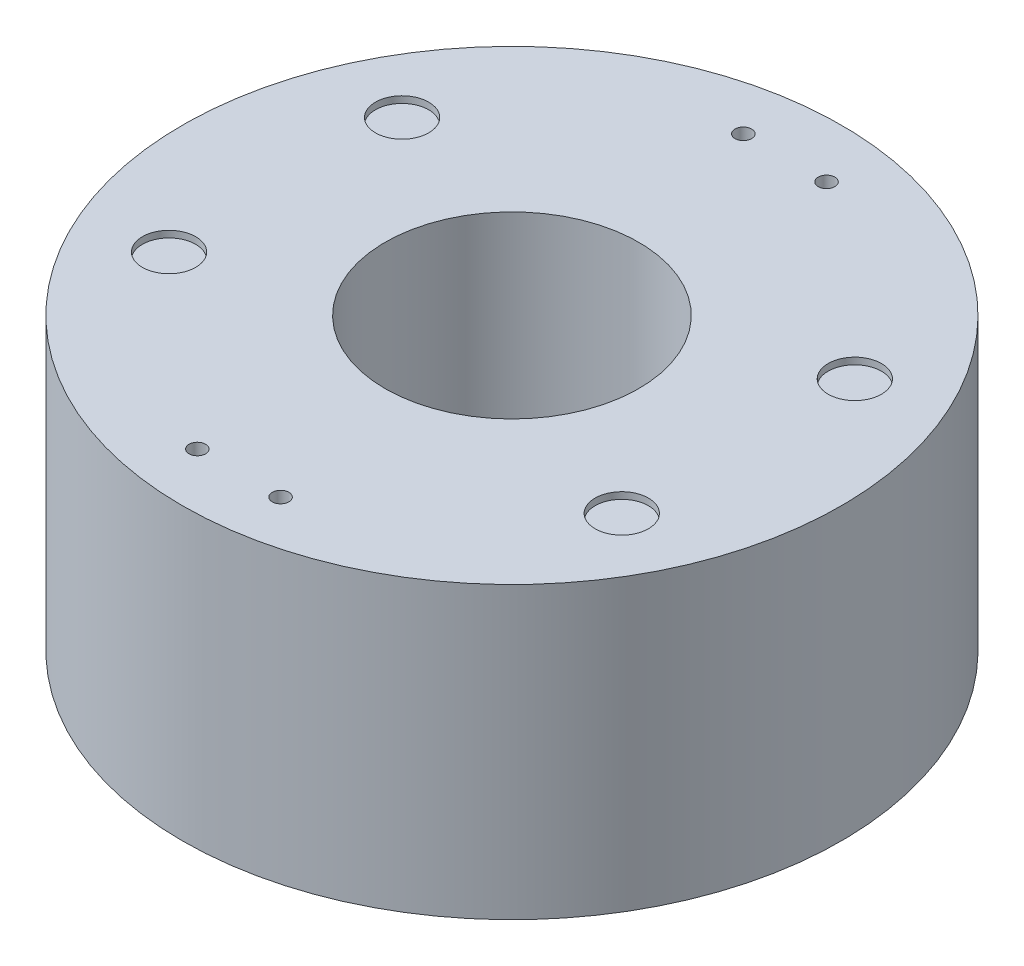
from build123d import *

# Parameters (mm, degrees)
ESQUISSE1_R                       = 30
ESQUISSE1_R_2                     = 19.05
BOSS_EXTRU_1_DEPTH                = 7
ESQUISSE2_R                       = 22.227955976
ESQUISSE2_R_2                     = 19.05
BOSS_EXTRU_2_DEPTH                = 1.7
ESQUISSE3_R                       = 49.5
ESQUISSE3_R_2                     = 19.05
BOSS_EXTRU_3_DEPTH                = 43.6
ENL_V_MAT_EXTRU_1_REACH           = 89.383
ESQUISSE5_R                       = 4
ENL_V_MAT_EXTRU_3_DEPTH           = 5
ENL_V_MAT_EXTRU_3_DEPTH_BACK      = 3
ESQUISSE6_R                       = 1.25
BOSS_EXTRU_4_START                = -1
ESQUISSE10_R                      = 4
BOSS_EXTRU_4_DEPTH                = 2
ENL_V_START                       = -4
ESQUISSE8_R                       = 45.5
ESQUISSE8_R_2                     = 23.05
ENL_V_MAT_EXTRU_5_DEPTH           = 35.6
BOSS_EXTRU_5_START                = 2
ESQUISSE11_R                      = 31.05
ESQUISSE11_R_2                    = 27.05
BOSS_EXTRU_5_DEPTH                = 3
BOSS_EXTRU_7_START                = -0.75
ESQUISSE14_R                      = 32.05
ESQUISSE14_R_2                    = 31.05
BOSS_EXTRU_7_DEPTH                = 1.5
ESQUISSE16_R                      = 3.5
BOSS_EXTRU_8_DEPTH                = 0.7
ESQUISSE17_R                      = 2.5
BOSS_EXTRU_9_DEPTH                = 1.6
ESQUISSE18_R                      = 3.5
BOSS_EXTRU_10_DEPTH               = 0.7
ESQUISSE19_R                      = 2
ENL_V_MAT_EXTRU_6_DEPTH           = 3
BOSS_EXTRU_11_START               = -3.7
ESQUISSE20_R                      = 1.445096473
BOSS_EXTRU_11_DEPTH               = 4.4
BOSS_EXTRU_12_DEPTH               = 0.7
R_P_TITION_LIN_AIRE1_OUTLINE_W    = 1.445096473
R_P_TITION_LIN_AIRE1_OUTLINE_H    = 4.4
R_P_TITION_LIN_AIRE1_2_OUTLINE_W  = 1.445096473
R_P_TITION_LIN_AIRE1_2_OUTLINE_H  = 4.4
R_P_TITION_LIN_AIRE1_3_OUTLINE_W  = 1.445096473
R_P_TITION_LIN_AIRE1_3_OUTLINE_H  = 4.4
R_P_TITION_LIN_AIRE1_4_OUTLINE_W  = 1.445096473
R_P_TITION_LIN_AIRE1_4_OUTLINE_H  = 4.4
R_P_TITION_LIN_AIRE1_5_OUTLINE_W  = 1.445096473
R_P_TITION_LIN_AIRE1_5_OUTLINE_H  = 4.4
R_P_TITION_START                  = 24.18
R_P_TITION_LIN_AIRE1_16_DEPTH     = 0.7
R_P_TITION_START_2                = 29.96
R_P_TITION_LIN_AIRE1_17_DEPTH     = 0.7
R_P_TITION_START_3                = 35.74
R_P_TITION_LIN_AIRE1_18_DEPTH     = 0.7
R_P_TITION_START_4                = 41.52
R_P_TITION_LIN_AIRE1_19_DEPTH     = 0.7
R_P_TITION_START_5                = 47.3
R_P_TITION_LIN_AIRE1_20_DEPTH     = 0.7
R_P_TITION_START_6                = 19.78
R_P_TITION_LIN_AIRE1_21_OUTLINE_R = 1.445096473
R_P_TITION_LIN_AIRE1_21_DEPTH     = 4.4
R_P_TITION_START_7                = 25.56
R_P_TITION_LIN_AIRE1_22_OUTLINE_R = 1.445096473
R_P_TITION_LIN_AIRE1_22_DEPTH     = 4.4
R_P_TITION_START_8                = 31.34
R_P_TITION_LIN_AIRE1_23_OUTLINE_R = 1.445096473
R_P_TITION_LIN_AIRE1_23_DEPTH     = 4.4
R_P_TITION_START_9                = 37.12
R_P_TITION_LIN_AIRE1_24_OUTLINE_R = 1.445096473
R_P_TITION_LIN_AIRE1_24_DEPTH     = 4.4
R_P_TITION_START_10               = 42.9
R_P_TITION_LIN_AIRE1_25_OUTLINE_R = 1.445096473
R_P_TITION_LIN_AIRE1_25_DEPTH     = 4.4


# Read off the part's stored shape, not the designer's step: Répétition linéaire1
with BuildPart() as part:
    # Esquisse1 → Boss.-Extru.1 (new body)
    with BuildSketch(Plane(origin=(0, 0, 0), x_dir=(1, 0, 0), z_dir=(0, 1, 0))):
        with Locations(Location((0, 0, 0), (0, 0, 270))):
            Circle(ESQUISSE1_R)
        with Locations(Location((0, 0, 0), (0, 0, 270))):
            Circle(ESQUISSE1_R_2, mode=Mode.SUBTRACT)
    extrude(amount=BOSS_EXTRU_1_DEPTH)

    # Esquisse2 → Boss.-Extru.2 (add)
    with BuildSketch(Plane(origin=(0, 7, 0), x_dir=(1, 0, 0), z_dir=(0, 1, 0))):
        with Locations(Location((0, 0, 0), (0, 0, 270))):
            Circle(ESQUISSE2_R)
        with Locations(Location((0, 0, 0), (0, 0, 270))):
            Circle(ESQUISSE2_R_2, mode=Mode.SUBTRACT)
    extrude(amount=BOSS_EXTRU_2_DEPTH)

    # Esquisse3 → Boss.-Extru.3 (add)
    with BuildSketch(Plane(origin=(0, 8.7, 0), x_dir=(1, 0, 0), z_dir=(0, 1, 0))):
        with Locations(Location((0, 0, 0), (0, 0, 270))):
            Circle(ESQUISSE3_R)
        with Locations(Location((0, 0, 0), (0, 0, 270))):
            Circle(ESQUISSE3_R_2, mode=Mode.SUBTRACT)
    extrude(amount=BOSS_EXTRU_3_DEPTH)

    # Esquisse5 → Enlèv. mat.-Extru.1 (cut, up to next)
    with BuildSketch(Plane(origin=(0, 52.3, 0), x_dir=(1, 0, 0), z_dir=(0, 1, 0)), mode=Mode.PRIVATE) as enl_v_mat_extru_1_sk1:
        with Locations(Location((34, -17.5, 0), (0, 0, 270))):
            Circle(ESQUISSE5_R)
    enl_v_mat_extru_1_tool1 = extrude(enl_v_mat_extru_1_sk1.sketch, amount=-ENL_V_MAT_EXTRU_1_REACH, mode=Mode.PRIVATE) & part.part
    # Esquisse5 → Enlèv. mat.-Extru.1 (cut, up to next)
    with BuildSketch(Plane(origin=(0, 52.3, 0), x_dir=(1, 0, 0), z_dir=(0, 1, 0)), mode=Mode.PRIVATE) as enl_v_mat_extru_1_sk2:
        with Locations(Location((-34, -17.5, 0), (0, 0, 270))):
            Circle(ESQUISSE5_R)
    enl_v_mat_extru_1_tool2 = extrude(enl_v_mat_extru_1_sk2.sketch, amount=-ENL_V_MAT_EXTRU_1_REACH, mode=Mode.PRIVATE) & part.part
    # Esquisse5 → Enlèv. mat.-Extru.1 (cut, up to next)
    with BuildSketch(Plane(origin=(0, 52.3, 0), x_dir=(1, 0, 0), z_dir=(0, 1, 0)), mode=Mode.PRIVATE) as enl_v_mat_extru_1_sk3:
        with Locations(Location((-34, 17.5, 0), (0, 0, 270))):
            Circle(ESQUISSE5_R)
    enl_v_mat_extru_1_tool3 = extrude(enl_v_mat_extru_1_sk3.sketch, amount=-ENL_V_MAT_EXTRU_1_REACH, mode=Mode.PRIVATE) & part.part
    # Esquisse5 → Enlèv. mat.-Extru.1 (cut, up to next)
    with BuildSketch(Plane(origin=(0, 52.3, 0), x_dir=(1, 0, 0), z_dir=(0, 1, 0)), mode=Mode.PRIVATE) as enl_v_mat_extru_1_sk4:
        with Locations(Location((34, 17.5, 0), (0, 0, 270))):
            Circle(ESQUISSE5_R)
    enl_v_mat_extru_1_tool4 = extrude(enl_v_mat_extru_1_sk4.sketch, amount=-ENL_V_MAT_EXTRU_1_REACH, mode=Mode.PRIVATE) & part.part
    add(enl_v_mat_extru_1_tool1.solids().sort_by_distance((34, 52.3, 17.5))[0], mode=Mode.SUBTRACT)
    add(enl_v_mat_extru_1_tool2.solids().sort_by_distance((-34, 52.3, 17.5))[0], mode=Mode.SUBTRACT)
    add(enl_v_mat_extru_1_tool3.solids().sort_by_distance((-34, 52.3, -17.5))[0], mode=Mode.SUBTRACT)
    add(enl_v_mat_extru_1_tool4.solids().sort_by_distance((34, 52.3, -17.5))[0], mode=Mode.SUBTRACT)

    # Esquisse6 → Enlèv. mat.-Extru.3 (cut, two sides: drawn at the far end of the back side and taken through both)
    with BuildSketch(Plane(origin=(0, 52.3, 0), x_dir=(1, 0, 0), z_dir=(0, 1, 0)).offset(-ENL_V_MAT_EXTRU_3_DEPTH_BACK)):
        with Locations(Location((-6.25, 41, 0), (0, 0, 270))):
            Circle(ESQUISSE6_R)
        with Locations(Location((6.25, 41, 0), (0, 0, 270))):
            Circle(ESQUISSE6_R)
        with Locations(Location((6.25, -41, 0), (0, 0, 270))):
            Circle(ESQUISSE6_R)
        with Locations(Location((-6.25, -41, 0), (0, 0, 270))):
            Circle(ESQUISSE6_R)
    extrude(amount=ENL_V_MAT_EXTRU_3_DEPTH + ENL_V_MAT_EXTRU_3_DEPTH_BACK, mode=Mode.SUBTRACT)

    # Esquisse10 → Boss.-Extru.4 (add)
    with BuildSketch(Plane(origin=(0, 52.3, 0), x_dir=(1, 0, 0), z_dir=(0, 1, 0)).offset(BOSS_EXTRU_4_START)):
        with Locations(Location((-34, 17.5, 0), (0, 0, 270))):
            Circle(ESQUISSE10_R)
        with Locations(Location((-34, -17.5, 0), (0, 0, 270))):
            Circle(ESQUISSE10_R)
        with Locations(Location((34, -17.5, 0), (0, 0, 270))):
            Circle(ESQUISSE10_R)
        with Locations(Location((34, 17.5, 0), (0, 0, 270))):
            Circle(ESQUISSE10_R)
    boss_extru_4 = extrude(amount=-BOSS_EXTRU_4_DEPTH)

    # Symétrie1: Boss.-Extru.4 across plane
    add(boss_extru_4.mirror(Plane.ZX.offset(30.5)))

    # Esquisse8 → Enlèv. mat.-Extru.5 (cut)
    with BuildSketch(Plane(origin=(0, 52.3, 0), x_dir=(1, 0, 0), z_dir=(0, 1, 0)).offset(ENL_V_START)):
        with Locations(Location((0, 0, 0), (0, 0, 270))):
            Circle(ESQUISSE8_R)
        with Locations(Location((0, 0, 0), (0, 0, 270))):
            Circle(ESQUISSE8_R_2, mode=Mode.SUBTRACT)
    extrude(amount=-ENL_V_MAT_EXTRU_5_DEPTH, mode=Mode.SUBTRACT)



with BuildPart() as body_2:
    # Esquisse11 → Boss.-Extru.5 (new body)
    with BuildSketch(Plane(origin=(0, 12.7, 0), x_dir=(1, 0, 0), z_dir=(0, 1, 0)).offset(BOSS_EXTRU_5_START)):
        with Locations(Location((0, 0, 0), (0, 0, 270))):
            Circle(ESQUISSE11_R)
        with Locations(Location((0, 0, 0), (0, 0, 270))):
            Circle(ESQUISSE11_R_2, mode=Mode.SUBTRACT)
    extrude(amount=BOSS_EXTRU_5_DEPTH)

    # Esquisse14 → Boss.-Extru.7 (add)
    with BuildSketch(Plane(origin=(0, 17.7, 0), x_dir=(1, 0, 0), z_dir=(0, 1, 0)).offset(BOSS_EXTRU_7_START)):
        with Locations(Location((0, 0, 0), (0, 0, 270))):
            Circle(ESQUISSE14_R)
        with Locations(Location((0, 0, 0), (0, 0, 270))):
            Circle(ESQUISSE14_R_2, mode=Mode.SUBTRACT)
    extrude(amount=-BOSS_EXTRU_7_DEPTH)


with BuildPart() as body_3:
    # Esquisse16 → Boss.-Extru.8 (new body)
    with BuildSketch(Plane(origin=(0, 17.7, 0), x_dir=(1, 0, 0), z_dir=(0, 1, 0))):
        with Locations(Location((-29.654973469, 17.728086432, 0), (0, 0, 270))):
            Circle(ESQUISSE16_R)
    extrude(amount=-BOSS_EXTRU_8_DEPTH)

    # Esquisse17 → Boss.-Extru.9 (add)
    with BuildSketch(Plane.XZ.offset(-17)):
        with Locations(Location((-29.654973469, -17.728086432, 0), (0, 0, 270))):
            Circle(ESQUISSE17_R)
    extrude(amount=BOSS_EXTRU_9_DEPTH)

    # Esquisse18 → Boss.-Extru.10 (add)
    with BuildSketch(Plane.XZ.offset(-15.4)):
        with Locations(Location((-29.654973469, -17.728086432, 0), (0, 0, 90))):
            Circle(ESQUISSE18_R)
    extrude(amount=BOSS_EXTRU_10_DEPTH)

    # Esquisse19 → Enlèv. mat.-Extru.6 (cut)
    with BuildSketch(Plane(origin=(0, 17.7, 0), x_dir=(1, 0, 0), z_dir=(0, 1, 0))):
        with Locations(Location((-29.654973469, 17.728086432, 0), (0, 0, 270))):
            Circle(ESQUISSE19_R)
    extrude(amount=-ENL_V_MAT_EXTRU_6_DEPTH, mode=Mode.SUBTRACT)


with BuildPart() as body_4:
    # Esquisse20 → Boss.-Extru.11 (new body)
    with BuildSketch(Plane(origin=(0, 17.7, 0), x_dir=(1, 0, 0), z_dir=(0, 1, 0)).offset(BOSS_EXTRU_11_START)):
        with Locations(Location((-29.654973469, 17.728086432, 0), (0, 0, 270))):
            Circle(ESQUISSE20_R)
    extrude(amount=BOSS_EXTRU_11_DEPTH)


with BuildPart() as part_1:
    add(part.part)

    add(body_4.part)  # Boss.-Extru.12 merges body 4
    # Esquisse21 → Boss.-Extru.12 (add)
    with BuildSketch(Plane(origin=(0, 18.4, 0), x_dir=(1, 0, 0), z_dir=(0, 1, 0))):
        with BuildLine():
            Line((-27.32174778, 17.416200938), (-23.925344481, 42.824806308))
            Line((-23.925344481, 42.824806308), (-29.153804513, 39.244171979))
            Line((-29.153804513, 39.244171979), (-31.988199158, 18.039971926))
            ThreePointArc((-31.988199158, 18.039971926), (-29.966858963, 15.394860743), (-27.32174778, 17.416200938))
        make_face()
    extrude(amount=BOSS_EXTRU_12_DEPTH)

    # R_p_tition lin_aire1 16 outline → R_p_tition lin_aire1 16 (add)
    with BuildSketch(Plane(origin=(0, 0, 0), x_dir=(1, 0, 0), z_dir=(0, 1, 0)).offset(R_P_TITION_START)):
        with BuildLine():
            Line((-27.32174778, 17.416200938), (-24.527071496, 38.323266612))
            ThreePointArc((-24.527071496, 38.323266612), (-27.237015579, 36.447153282), (-29.804033932, 34.379784196))
            Line((-29.804033932, 34.379784196), (-31.988199158, 18.039971926))
            ThreePointArc((-31.988199158, 18.039971926), (-29.966858963, 15.394860743), (-27.32174778, 17.416200938))
        make_face()
    extrude(amount=R_P_TITION_LIN_AIRE1_16_DEPTH)

    # R_p_tition lin_aire1 17 outline → R_p_tition lin_aire1 17 (add)
    with BuildSketch(Plane(origin=(0, 0, 0), x_dir=(1, 0, 0), z_dir=(0, 1, 0)).offset(R_P_TITION_START_2)):
        with BuildLine():
            Line((-27.32174778, 17.416200938), (-24.527071496, 38.323266612))
            ThreePointArc((-24.527071496, 38.323266612), (-27.237015579, 36.447153282), (-29.804033932, 34.379784196))
            Line((-29.804033932, 34.379784196), (-31.988199158, 18.039971926))
            ThreePointArc((-31.988199158, 18.039971926), (-29.966858963, 15.394860743), (-27.32174778, 17.416200938))
        make_face()
    extrude(amount=R_P_TITION_LIN_AIRE1_17_DEPTH)

    # R_p_tition lin_aire1 18 outline → R_p_tition lin_aire1 18 (add)
    with BuildSketch(Plane(origin=(0, 0, 0), x_dir=(1, 0, 0), z_dir=(0, 1, 0)).offset(R_P_TITION_START_3)):
        with BuildLine():
            Line((-27.32174778, 17.416200938), (-24.527071496, 38.323266612))
            ThreePointArc((-24.527071496, 38.323266612), (-27.237015579, 36.447153282), (-29.804033932, 34.379784196))
            Line((-29.804033932, 34.379784196), (-31.988199158, 18.039971926))
            ThreePointArc((-31.988199158, 18.039971926), (-29.966858963, 15.394860743), (-27.32174778, 17.416200938))
        make_face()
    extrude(amount=R_P_TITION_LIN_AIRE1_18_DEPTH)

    # R_p_tition lin_aire1 19 outline → R_p_tition lin_aire1 19 (add)
    with BuildSketch(Plane(origin=(0, 0, 0), x_dir=(1, 0, 0), z_dir=(0, 1, 0)).offset(R_P_TITION_START_4)):
        with BuildLine():
            Line((-27.32174778, 17.416200938), (-24.527071496, 38.323266612))
            ThreePointArc((-24.527071496, 38.323266612), (-27.237015579, 36.447153282), (-29.804033932, 34.379784196))
            Line((-29.804033932, 34.379784196), (-31.988199158, 18.039971926))
            ThreePointArc((-31.988199158, 18.039971926), (-29.966858963, 15.394860743), (-27.32174778, 17.416200938))
        make_face()
    extrude(amount=R_P_TITION_LIN_AIRE1_19_DEPTH)

    # R_p_tition lin_aire1 20 outline → R_p_tition lin_aire1 20 (add)
    with BuildSketch(Plane(origin=(0, 0, 0), x_dir=(1, 0, 0), z_dir=(0, 1, 0)).offset(R_P_TITION_START_5)):
        with BuildLine():
            Line((-27.32174778, 17.416200938), (-24.527071496, 38.323266612))
            ThreePointArc((-24.527071496, 38.323266612), (-27.237015579, 36.447153282), (-29.804033932, 34.379784196))
            Line((-29.804033932, 34.379784196), (-31.988199158, 18.039971926))
            ThreePointArc((-31.988199158, 18.039971926), (-29.966858963, 15.394860743), (-27.32174778, 17.416200938))
        make_face()
    extrude(amount=R_P_TITION_LIN_AIRE1_20_DEPTH)

    # R_p_tition lin_aire1 21 outline → R_p_tition lin_aire1 21 (add)
    with BuildSketch(Plane(origin=(0, 0, 0), x_dir=(1, 0, 0), z_dir=(0, 1, 0)).offset(R_P_TITION_START_6)):
        with Locations((-29.654973469, 17.728086432)):
            Circle(R_P_TITION_LIN_AIRE1_21_OUTLINE_R)
    extrude(amount=R_P_TITION_LIN_AIRE1_21_DEPTH)

    # R_p_tition lin_aire1 22 outline → R_p_tition lin_aire1 22 (add)
    with BuildSketch(Plane(origin=(0, 0, 0), x_dir=(1, 0, 0), z_dir=(0, 1, 0)).offset(R_P_TITION_START_7)):
        with Locations((-29.654973469, 17.728086432)):
            Circle(R_P_TITION_LIN_AIRE1_22_OUTLINE_R)
    extrude(amount=R_P_TITION_LIN_AIRE1_22_DEPTH)

    # R_p_tition lin_aire1 23 outline → R_p_tition lin_aire1 23 (add)
    with BuildSketch(Plane(origin=(0, 0, 0), x_dir=(1, 0, 0), z_dir=(0, 1, 0)).offset(R_P_TITION_START_8)):
        with Locations((-29.654973469, 17.728086432)):
            Circle(R_P_TITION_LIN_AIRE1_23_OUTLINE_R)
    extrude(amount=R_P_TITION_LIN_AIRE1_23_DEPTH)

    # R_p_tition lin_aire1 24 outline → R_p_tition lin_aire1 24 (add)
    with BuildSketch(Plane(origin=(0, 0, 0), x_dir=(1, 0, 0), z_dir=(0, 1, 0)).offset(R_P_TITION_START_9)):
        with Locations((-29.654973469, 17.728086432)):
            Circle(R_P_TITION_LIN_AIRE1_24_OUTLINE_R)
    extrude(amount=R_P_TITION_LIN_AIRE1_24_DEPTH)

    # R_p_tition lin_aire1 25 outline → R_p_tition lin_aire1 25 (add)
    with BuildSketch(Plane(origin=(0, 0, 0), x_dir=(1, 0, 0), z_dir=(0, 1, 0)).offset(R_P_TITION_START_10)):
        with Locations((-29.654973469, 17.728086432)):
            Circle(R_P_TITION_LIN_AIRE1_25_OUTLINE_R)
    extrude(amount=R_P_TITION_LIN_AIRE1_25_DEPTH)


with BuildPart() as body_4_2:
    # Répétition linéaire1 outline → Répétition linéaire1 (revolve)
    with BuildSketch(Plane(origin=(-29.654973469, 0, -17.728086432), x_dir=(1, 0, 0), z_dir=(0, 0, 1))):
        with Locations((0.722548236, 45.1)):
            Rectangle(R_P_TITION_LIN_AIRE1_OUTLINE_W, R_P_TITION_LIN_AIRE1_OUTLINE_H)
    revolve(axis=Axis((-29.654973469, 0, -17.728086432), (0, 1, 0)))


with BuildPart() as body_5:
    # R_p_tition lin_aire1 2 outline → R_p_tition lin_aire1 2 (revolve)
    with BuildSketch(Plane(origin=(-29.654973469, 0, -17.728086432), x_dir=(1, 0, 0), z_dir=(0, 0, 1))):
        with Locations((0.722548236, 39.32)):
            Rectangle(R_P_TITION_LIN_AIRE1_2_OUTLINE_W, R_P_TITION_LIN_AIRE1_2_OUTLINE_H)
    revolve(axis=Axis((-29.654973469, 0, -17.728086432), (0, 1, 0)))


with BuildPart() as body_6:
    # R_p_tition lin_aire1 3 outline → R_p_tition lin_aire1 3 (revolve)
    with BuildSketch(Plane(origin=(-29.654973469, 0, -17.728086432), x_dir=(1, 0, 0), z_dir=(0, 0, 1))):
        with Locations((0.722548236, 33.54)):
            Rectangle(R_P_TITION_LIN_AIRE1_3_OUTLINE_W, R_P_TITION_LIN_AIRE1_3_OUTLINE_H)
    revolve(axis=Axis((-29.654973469, 0, -17.728086432), (0, 1, 0)))


with BuildPart() as body_7:
    # R_p_tition lin_aire1 4 outline → R_p_tition lin_aire1 4 (revolve)
    with BuildSketch(Plane(origin=(-29.654973469, 0, -17.728086432), x_dir=(1, 0, 0), z_dir=(0, 0, 1))):
        with Locations((0.722548236, 27.76)):
            Rectangle(R_P_TITION_LIN_AIRE1_4_OUTLINE_W, R_P_TITION_LIN_AIRE1_4_OUTLINE_H)
    revolve(axis=Axis((-29.654973469, 0, -17.728086432), (0, 1, 0)))


with BuildPart() as body_8:
    # R_p_tition lin_aire1 5 outline → R_p_tition lin_aire1 5 (revolve)
    with BuildSketch(Plane(origin=(-29.654973469, 0, -17.728086432), x_dir=(1, 0, 0), z_dir=(0, 0, 1))):
        with Locations((0.722548236, 21.98)):
            Rectangle(R_P_TITION_LIN_AIRE1_5_OUTLINE_W, R_P_TITION_LIN_AIRE1_5_OUTLINE_H)
    revolve(axis=Axis((-29.654973469, 0, -17.728086432), (0, 1, 0)))


with BuildPart() as body_9:
    # R_p_tition lin_aire1 6 outline → R_p_tition lin_aire1 6 (revolve)
    with BuildSketch(Plane(origin=(-29.654973469, 0, -17.728086432), x_dir=(1, 0, 0), z_dir=(0, 0, 1))):
        Polygon((2.5, 45.9), (3.5, 45.9), (3.5, 46.6), (2, 46.6), (2, 43.6), (3.5, 43.6), (3.5, 44.3), (2.5, 44.3), align=None)
    revolve(axis=Axis((-29.654973469, 0, -17.728086432), (0, 1, 0)))


with BuildPart() as body_10:
    # R_p_tition lin_aire1 7 outline → R_p_tition lin_aire1 7 (revolve)
    with BuildSketch(Plane(origin=(-29.654973469, 0, -17.728086432), x_dir=(1, 0, 0), z_dir=(0, 0, 1))):
        Polygon((2.5, 40.12), (3.5, 40.12), (3.5, 40.82), (2, 40.82), (2, 37.82), (3.5, 37.82), (3.5, 38.52), (2.5, 38.52), align=None)
    revolve(axis=Axis((-29.654973469, 0, -17.728086432), (0, 1, 0)))


with BuildPart() as body_11:
    # R_p_tition lin_aire1 8 outline → R_p_tition lin_aire1 8 (revolve)
    with BuildSketch(Plane(origin=(-29.654973469, 0, -17.728086432), x_dir=(1, 0, 0), z_dir=(0, 0, 1))):
        Polygon((2.5, 34.34), (3.5, 34.34), (3.5, 35.04), (2, 35.04), (2, 32.04), (3.5, 32.04), (3.5, 32.74), (2.5, 32.74), align=None)
    revolve(axis=Axis((-29.654973469, 0, -17.728086432), (0, 1, 0)))


with BuildPart() as body_12:
    # R_p_tition lin_aire1 9 outline → R_p_tition lin_aire1 9 (revolve)
    with BuildSketch(Plane(origin=(-29.654973469, 0, -17.728086432), x_dir=(1, 0, 0), z_dir=(0, 0, 1))):
        Polygon((2.5, 28.56), (3.5, 28.56), (3.5, 29.26), (2, 29.26), (2, 26.26), (3.5, 26.26), (3.5, 26.96), (2.5, 26.96), align=None)
    revolve(axis=Axis((-29.654973469, 0, -17.728086432), (0, 1, 0)))


with BuildPart() as body_13:
    # R_p_tition lin_aire1 10 outline → R_p_tition lin_aire1 10 (revolve)
    with BuildSketch(Plane(origin=(-29.654973469, 0, -17.728086432), x_dir=(1, 0, 0), z_dir=(0, 0, 1))):
        Polygon((2.5, 22.78), (3.5, 22.78), (3.5, 23.48), (2, 23.48), (2, 20.48), (3.5, 20.48), (3.5, 21.18), (2.5, 21.18), align=None)
    revolve(axis=Axis((-29.654973469, 0, -17.728086432), (0, 1, 0)))


with BuildPart() as body_14:
    # R_p_tition lin_aire1 11 outline → R_p_tition lin_aire1 11 (revolve)
    with BuildSketch(Plane.XY):
        Polygon((32.05, 45.85), (31.05, 45.85), (31.05, 46.6), (27.05, 46.6), (27.05, 43.6), (31.05, 43.6), (31.05, 44.35), (32.05, 44.35), align=None)
    revolve(axis=Axis((0, 0, 0), (0, 1, 0)))


with BuildPart() as body_15:
    # R_p_tition lin_aire1 12 outline → R_p_tition lin_aire1 12 (revolve)
    with BuildSketch(Plane.XY):
        Polygon((32.05, 40.07), (31.05, 40.07), (31.05, 40.82), (27.05, 40.82), (27.05, 37.82), (31.05, 37.82), (31.05, 38.57), (32.05, 38.57), align=None)
    revolve(axis=Axis((0, 0, 0), (0, 1, 0)))


with BuildPart() as body_16:
    # R_p_tition lin_aire1 13 outline → R_p_tition lin_aire1 13 (revolve)
    with BuildSketch(Plane.XY):
        Polygon((32.05, 34.29), (31.05, 34.29), (31.05, 35.04), (27.05, 35.04), (27.05, 32.04), (31.05, 32.04), (31.05, 32.79), (32.05, 32.79), align=None)
    revolve(axis=Axis((0, 0, 0), (0, 1, 0)))


with BuildPart() as body_17:
    # R_p_tition lin_aire1 14 outline → R_p_tition lin_aire1 14 (revolve)
    with BuildSketch(Plane.XY):
        Polygon((32.05, 28.51), (31.05, 28.51), (31.05, 29.26), (27.05, 29.26), (27.05, 26.26), (31.05, 26.26), (31.05, 27.01), (32.05, 27.01), align=None)
    revolve(axis=Axis((0, 0, 0), (0, 1, 0)))


with BuildPart() as body_18:
    # R_p_tition lin_aire1 15 outline → R_p_tition lin_aire1 15 (revolve)
    with BuildSketch(Plane.XY):
        Polygon((32.05, 22.73), (31.05, 22.73), (31.05, 23.48), (27.05, 23.48), (27.05, 20.48), (31.05, 20.48), (31.05, 21.23), (32.05, 21.23), align=None)
    revolve(axis=Axis((0, 0, 0), (0, 1, 0)))


solid = Compound([body_2.part, body_3.part, part_1.part, body_4_2.part, body_5.part, body_6.part, body_7.part, body_8.part, body_9.part, body_10.part, body_11.part, body_12.part, body_13.part, body_14.part, body_15.part, body_16.part, body_17.part, body_18.part])
